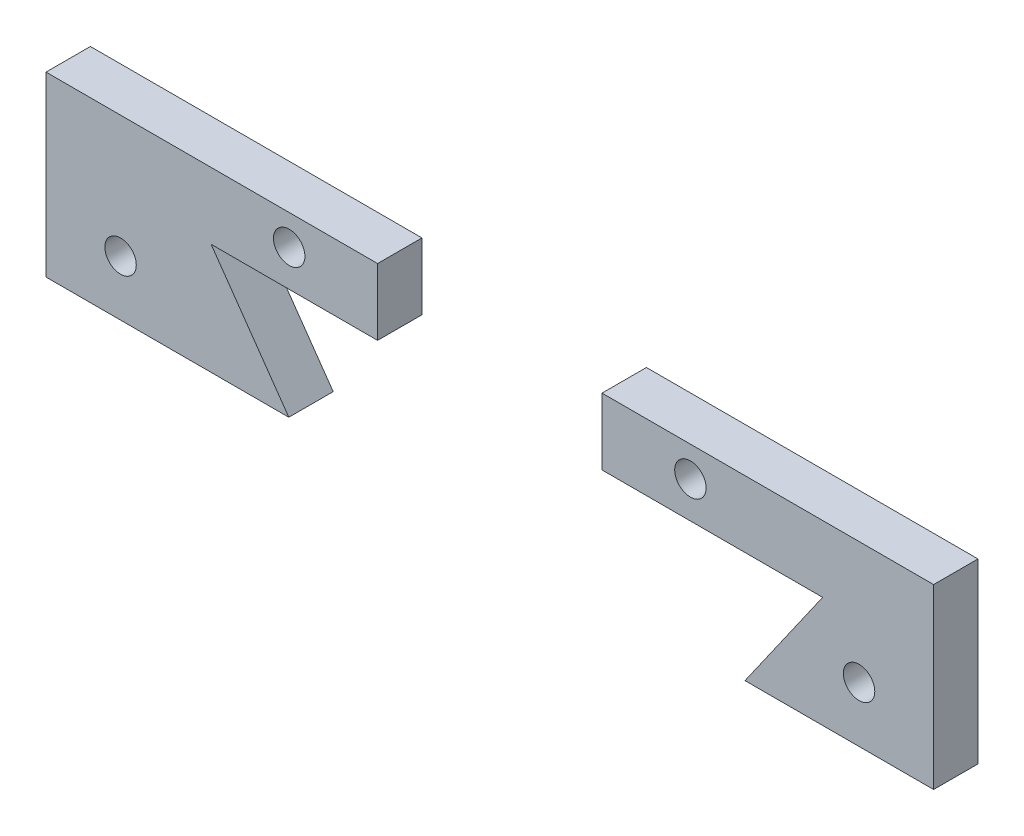
from build123d import *

# Parameters (mm, degrees)
BOSS_EXTRUDE1_DEPTH            = 6.35
BOSS_EXTRUDE1_2_DEPTH          = 6.35
SKETCH3_W                      = 2.2479
SKETCH3_H                      = 6.35
F_8_CLEARANCE_HOLE1_AT_2_COUNT = 2
F_8_CLEARANCE_HOLE1_AT_2_PITCH = 27.477896212
F_8_CLEARANCE_HOLE1_AT_3_COUNT = 2
F_8_CLEARANCE_HOLE1_AT_3_PITCH = 82.586748551
F_8_CLEARANCE_HOLE1_AT_4_COUNT = 2
F_8_CLEARANCE_HOLE1_AT_4_PITCH = 105.664


with BuildPart() as part:
    # Sketch1 → Boss-Extrude1 (new body)
    with BuildSketch(Plane.XY):
        Polygon((-28.757286692, 0), (-63.5, 0), (-63.5, 25.4), (-16.056336319, 25.4), (-16.056336319, 15.875), (-39.873081361, 15.875), align=None)
    extrude(amount=BOSS_EXTRUDE1_DEPTH)

    # Sketch3 → #8 Clearance Hole1 (revolve, cut)
    with BuildSketch(Plane(origin=(-52.832, 7.9375, 6.35), x_dir=(0, -1, 0), z_dir=(1, 0, 0))):
        with Locations((1.12395, 3.175)):
            Rectangle(SKETCH3_W, SKETCH3_H)
    f_8_clearance_hole1 = revolve(axis=Axis((-52.832, 7.9375, 12.7), (0, 0, -1)), mode=Mode.SUBTRACT)

    # #8 Clearance Hole1 at 2: #8 Clearance Hole1 ×2
    with Locations(*[Vector(0.8781603880307779, 0.4783663166378186, 0) * (i * F_8_CLEARANCE_HOLE1_AT_2_PITCH) for i in range(1, F_8_CLEARANCE_HOLE1_AT_2_COUNT)]):
        add(f_8_clearance_hole1, mode=Mode.SUBTRACT)


with BuildPart() as body_2:
    # Sketch1 → Boss-Extrude1 2 (new body)
    with BuildSketch(Plane.XY):
        Polygon((36.509205331, 0), (47.625, 15.875), (16.056336319, 15.875), (16.056336319, 25.4), (63.5, 25.4), (63.5, 0), align=None)
    extrude(amount=BOSS_EXTRUDE1_2_DEPTH)

    # #8 Clearance Hole1 at 3: #8 Clearance Hole1 ×2
    with Locations(*[Vector(0.9872528151354362, 0.1591599164587503, 0) * (i * F_8_CLEARANCE_HOLE1_AT_3_PITCH) for i in range(1, F_8_CLEARANCE_HOLE1_AT_3_COUNT)]):
        add(f_8_clearance_hole1, mode=Mode.SUBTRACT)

    # #8 Clearance Hole1 at 4: #8 Clearance Hole1 ×2
    with Locations(*[(i * F_8_CLEARANCE_HOLE1_AT_4_PITCH, 0, 0) for i in range(1, F_8_CLEARANCE_HOLE1_AT_4_COUNT)]):
        add(f_8_clearance_hole1, mode=Mode.SUBTRACT)


solid = Compound([part.part, body_2.part])
